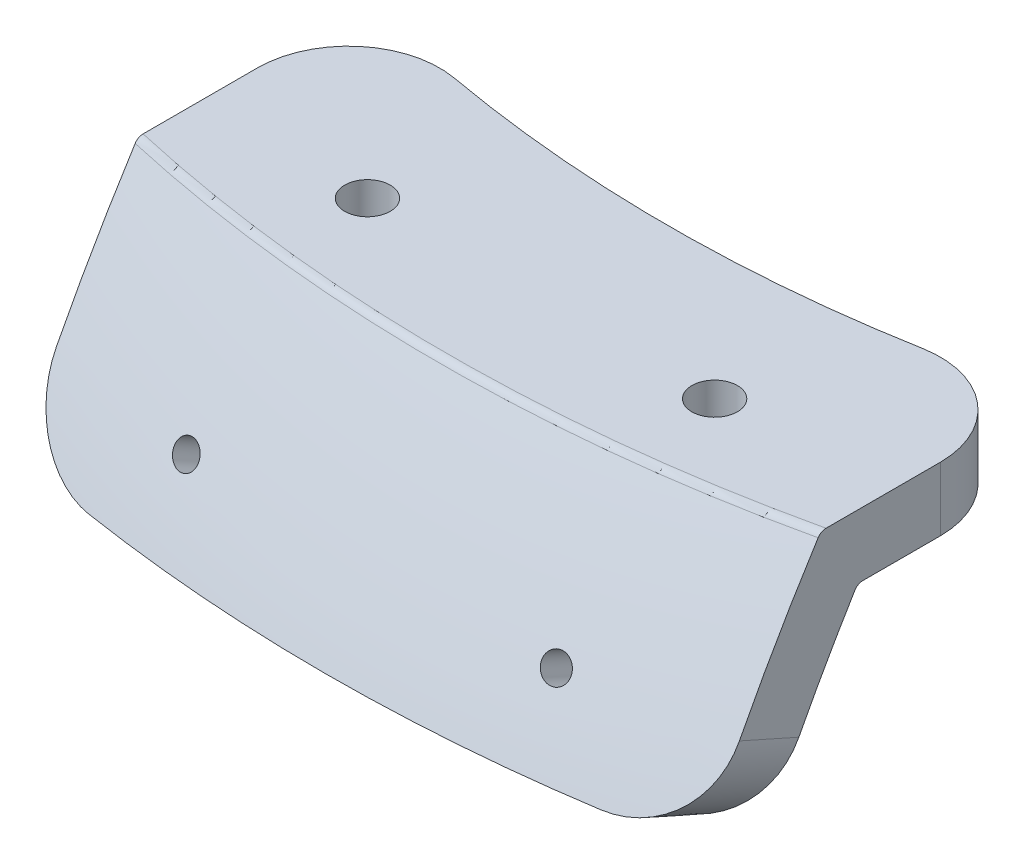
from build123d import *

# Parameters (mm, degrees)
REVOLVE1_ANGLE     = 30.000000000000068
SKETCH5_OUTSIDE_W  = 117.778
SKETCH5_OUTSIDE_H  = 65.886
CUT_EXTRUDE2_DEPTH = 260.76149135356775
FILLET1_R          = 10
FILLET2_R          = 1
SKETCH6_R          = 2.499999999999999
CUT_EXTRUDE3_DEPTH = 189.07070419365607


with BuildPart() as part:
    # Sketch1 → Revolve1 (revolve, symmetric)
    with BuildSketch(Plane(origin=(0, 0, 0), x_dir=(0, 0, -1), z_dir=(1, 0, 0))) as revolve1_sk:
        with BuildLine():
            Line((-182.35774731109075, 155.06255495822683), (-175.97602387063264, 152.18616730537))
            ThreePointArc((-175.97602387063264, 152.18616730537), (-171.12326361620543, 162.17531665611477), (-165.70405663890074, 171.86884968466347))
            Line((-165.70405663890074, 171.86884968466347), (-144.78715490957802, 171.8688496846635))
            Line((-144.78715490957802, 171.8688496846635), (-144.78715490957802, 178.86884968466353))
            Line((-144.78715490957802, 178.86884968466353), (-169.62958875117425, 178.8688496846635))
            ThreePointArc((-169.62958875117425, 178.8688496846635), (-176.3957372053048, 167.18067068421345), (-182.35774731109075, 155.06255495822683))
        make_face()
    revolve(axis=Axis((0, 0, 0), (0, 1, 0)), revolution_arc=REVOLVE1_ANGLE / 2)
    revolve(revolve1_sk.sketch, axis=Axis((0, 0, 0), (0, -1, 0)), revolution_arc=REVOLVE1_ANGLE / 2)

    # Sketch4 → Cut-Revolve1 (revolve, cut)
    with BuildSketch(Plane(origin=(0, 57.85077924674397, -29.47644429930001), x_dir=(0, 0.4539904997395446, 0.891006524188369), z_dir=(0, -0.891006524188369, 0.4539904997395446))):
        Polygon((200.3216852155454, 19.031606271083962), (239.0176946479082, 22.417068420107935), (239.1484282620297, 20.922776372970326), (200.4524188296669, 17.53731422394635), align=None)
    cut_revolve1 = revolve(axis=Axis((-17.53731422394635, 148.85427304522494, 149.12796866727265), (-0.08715574274765833, 0.4522629288245563, 0.8876159753616077)), mode=Mode.SUBTRACT)

    # Mirror1: Cut-Revolve1 across plane
    add(cut_revolve1.mirror(Plane(origin=(0, 0, 0), x_dir=(0, 0, 1), z_dir=(1, 0, 0))), mode=Mode.SUBTRACT)

    # Sketch5 outside → Cut-Extrude2 (cut, through all)
    with BuildSketch(Plane(origin=(0, 0, 0), x_dir=(1, 0, 0), z_dir=(0, 1, 0))):
        with Locations((0, -161.106)):
            Rectangle(SKETCH5_OUTSIDE_W, SKETCH5_OUTSIDE_H)
        Polygon((37.473673176807814, -139.85365224207746), (-37.473673176807814, -139.85365224207746), (-37.47367317680781, -182.35774731109072), (37.47367317680782, -182.35774731109072), align=None, mode=Mode.SUBTRACT)
    extrude(amount=CUT_EXTRUDE2_DEPTH, mode=Mode.SUBTRACT)

    # Fillet1
    fillet1_edges = [part.edges().sort_by_distance(p)[0] for p in [
        (-37.47367317680782, 175.36884968466353, 139.85365224207746),
        (37.47367317680782, 175.36884968466353, 139.85365224207746),
        (-37.47367317680781, 153.6238703887916, 175.20304381323552),
        (37.47367317680782, 153.6238703887916, 175.2030438132355),
    ]]
    fillet(fillet1_edges, radius=FILLET1_R)

    # Fillet2
    fillet2_edges = [part.edges().sort_by_distance(p)[0] for p in [
        (2.132e-14, 178.86884968466353, 169.62958875117428),
        (1.421e-14, 171.86884968466347, 165.7040566389007),
    ]]
    fillet(fillet2_edges, radius=FILLET2_R)

    # Sketch6 → Cut-Extrude3 (cut, through all)
    with BuildSketch(Plane(origin=(0, 178.8688496846635, 0), x_dir=(1, 0, 0), z_dir=(0, 1, 0))):
        with Locations((19.049999999999898, -158.67424557151682)):
            Circle(SKETCH6_R)
        with Locations((-19.050000000000104, -158.67424557151682)):
            Circle(SKETCH6_R)
    extrude(amount=-CUT_EXTRUDE3_DEPTH, mode=Mode.SUBTRACT)


solid = part.part
